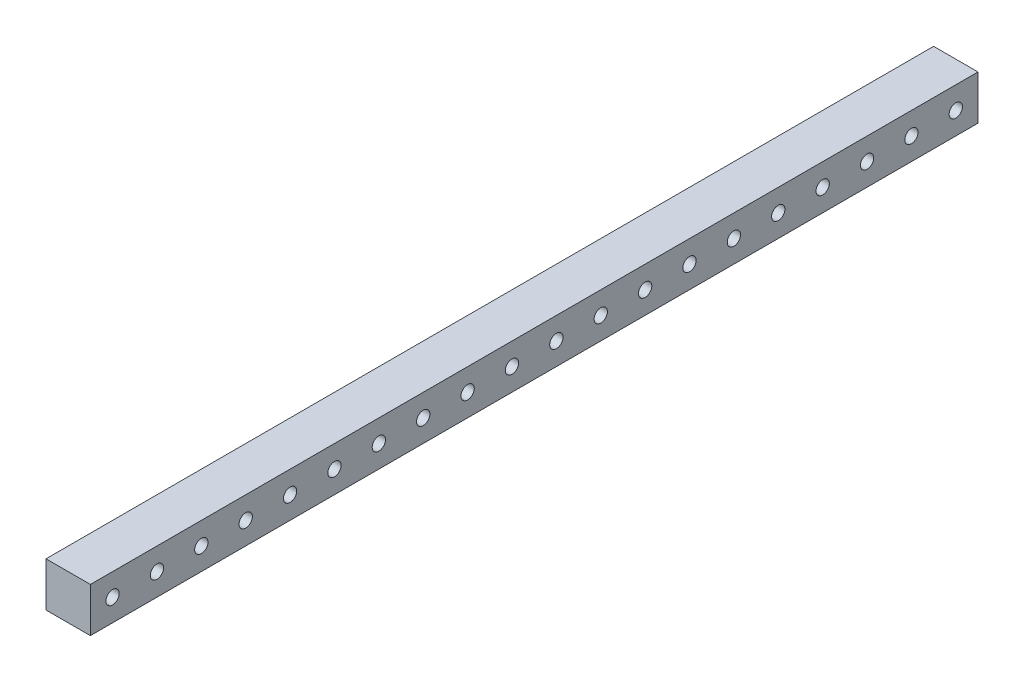
from build123d import *

# Parameters (mm, degrees)
SKETCH1_W             = 20
SKETCH1_H             = 20
BOSS_EXTRUDE1_DEPTH   = 400
F_6_0MM_DOWEL_HOLE1_D = 6
LPATTERN2_COUNT       = 20
LPATTERN2_PITCH       = 20


with BuildPart() as part:
    # Sketch1 → Boss-Extrude1 (new body)
    with BuildSketch(Plane.XY):
        Rectangle(SKETCH1_W, SKETCH1_H)
    extrude(amount=BOSS_EXTRUDE1_DEPTH)

    # Ø6.0mm Dowel Hole1 (through all)
    with Locations(Plane(origin=(10, 0, 0), x_dir=(0, 0, -1), z_dir=(1, 0, 0))):
        with Locations((-10, 0)):
            f_6_0mm_dowel_hole1 = Hole(F_6_0MM_DOWEL_HOLE1_D / 2)

    # LPattern2: Ø6.0mm Dowel Hole1 ×20
    with Locations(*[(0, 0, i * LPATTERN2_PITCH) for i in range(1, LPATTERN2_COUNT)]):
        add(f_6_0mm_dowel_hole1, mode=Mode.SUBTRACT)


solid = part.part
